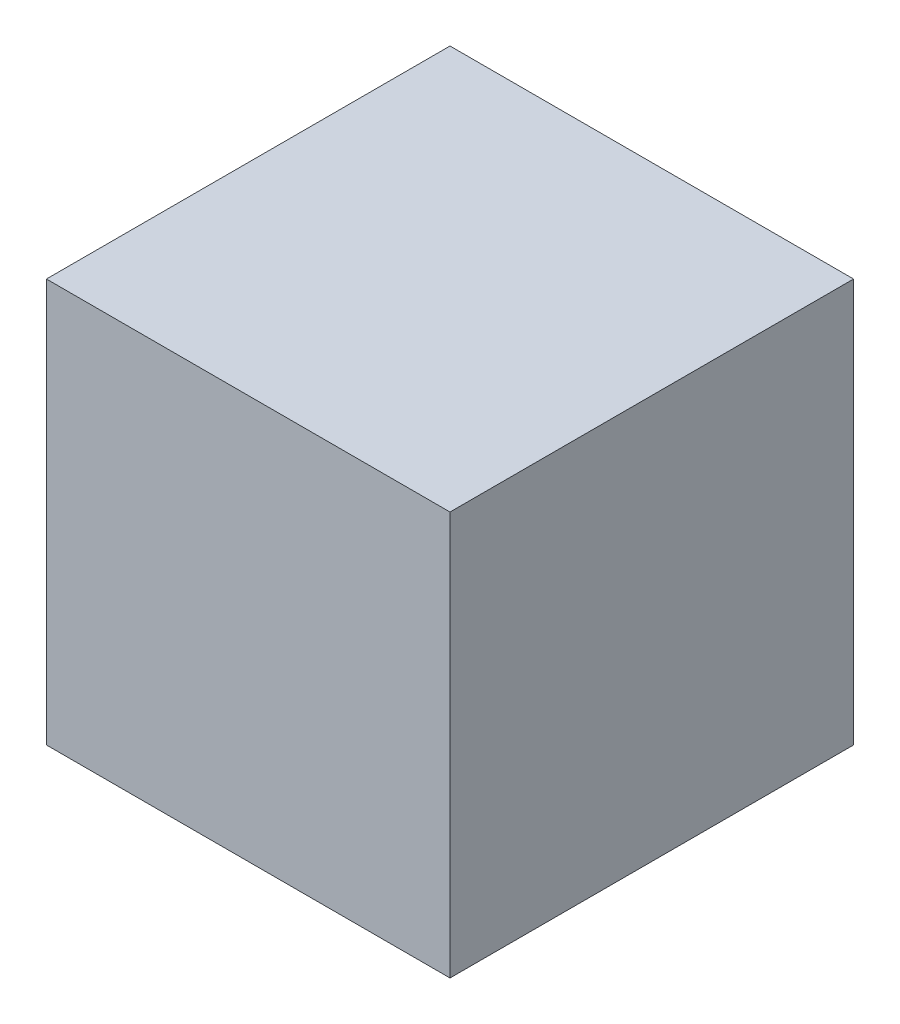
from build123d import *

# Parameters (mm, degrees)
SKETCH1_W           = 60
SKETCH1_H           = 60
BOSS_EXTRUDE1_DEPTH = 60
SKETCH2_W           = 55
SKETCH2_H           = 55
BOSS_EXTRUDE2_DEPTH = 57.5
SKETCH2_2_W         = 55
SKETCH2_2_H         = 55
CUT_EXTRUDE1_DEPTH  = 57.5
SKETCH5_W           = 50
SKETCH5_H           = 50
CUT_EXTRUDE2_DEPTH  = 20
SKETCH6_W           = 30
SKETCH6_H           = 3.5
CUT_EXTRUDE3_DEPTH  = 20
SKETCH7_R           = 0.5
CUT_EXTRUDE4_DEPTH  = 3.3


with BuildPart() as part:
    # Sketch1 → Boss-Extrude1 (new body)
    with BuildSketch(Plane(origin=(0, 0, 0), x_dir=(1, 0, 0), z_dir=(0, 1, 0))):
        Rectangle(SKETCH1_W, SKETCH1_H)
    extrude(amount=BOSS_EXTRUDE1_DEPTH)

    # Sketch2 → Boss-Extrude2 (add)
    with BuildSketch(Plane.XZ):
        Rectangle(SKETCH2_W, SKETCH2_H)
    extrude(amount=-BOSS_EXTRUDE2_DEPTH)

    # Sketch2<2> → Cut-Extrude1 (cut)
    with BuildSketch(Plane.XZ):
        Rectangle(SKETCH2_2_W, SKETCH2_2_H)
    extrude(amount=-CUT_EXTRUDE1_DEPTH, mode=Mode.SUBTRACT)

    # Sketch5 → Cut-Extrude2 (cut)
    with BuildSketch(Plane(origin=(0, 0, -30), x_dir=(-1, 0, 0), z_dir=(0, 0, -1))):
        with Locations((0, 30)):
            Rectangle(SKETCH5_W, SKETCH5_H)
    extrude(amount=-CUT_EXTRUDE2_DEPTH, mode=Mode.SUBTRACT)

    # Sketch6 → Cut-Extrude3 (cut)
    with BuildSketch(Plane(origin=(0, 0, -30), x_dir=(-1, 0, 0), z_dir=(0, 0, -1))):
        with Locations((0, 3)):
            Rectangle(SKETCH6_W, SKETCH6_H)
    extrude(amount=-CUT_EXTRUDE3_DEPTH, mode=Mode.SUBTRACT)

    # Sketch7 → Cut-Extrude4 (cut)
    with BuildSketch(Plane(origin=(0, 0, -30), x_dir=(-1, 0, 0), z_dir=(0, 0, -1))):
        with Locations((10, 0.6)):
            Circle(SKETCH7_R)
    cut_extrude4 = extrude(amount=-CUT_EXTRUDE4_DEPTH, mode=Mode.SUBTRACT)

    # Mirror1: Cut-Extrude4 across plane
    add(cut_extrude4.mirror(Plane.ZY), mode=Mode.SUBTRACT)


solid = part.part
